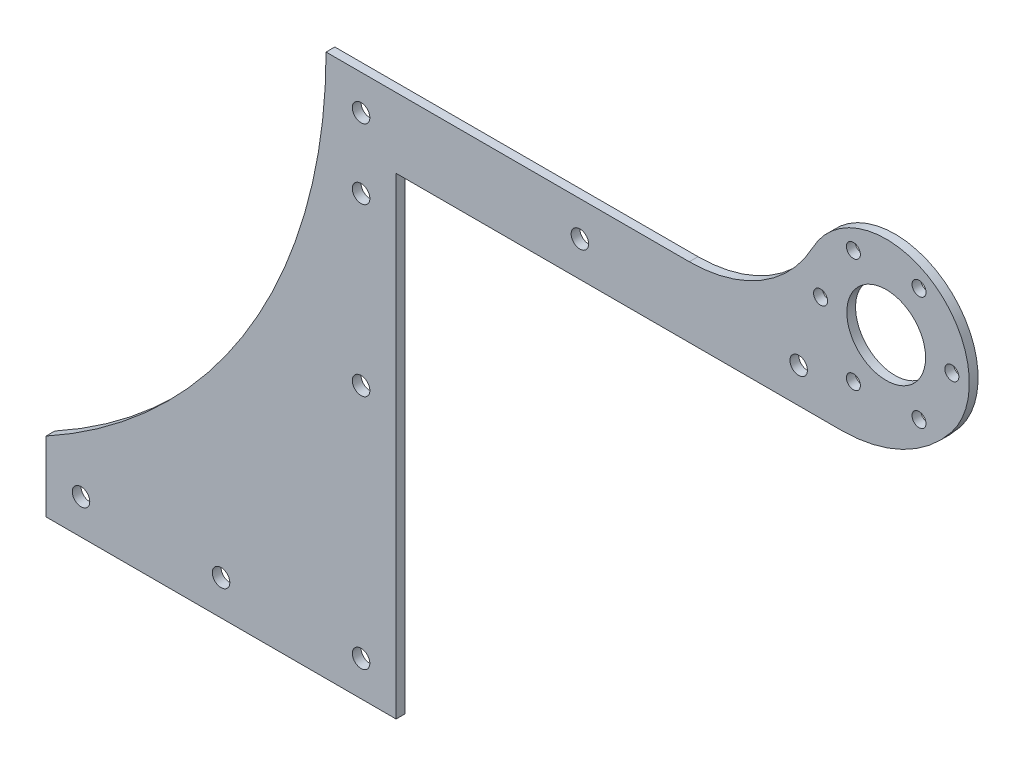
from build123d import *

# Parameters (mm, degrees)
SKETCH1_R          = 3.175
SKETCH1_R_2        = 14.2875
SKETCH1_R_3        = 2.54
BASE_FLANGE1_DEPTH = 3.175


# Sheet-metal steps are written as plain solids
with BuildPart() as part:
    # Sketch1 → Base-Flange1 (new body)
    with BuildSketch(Plane.XY):
        with BuildLine():
            Line((0, 0), (-127, 0))
            Line((-127, 0), (-127, 25.4))
            ThreePointArc((-127, 25.4), (-52.707547813, 97.203546852), (-25.4, 196.85))
            Line((-25.4, 196.85), (0, 196.85))
            Line((0, 196.85), (106.3625, 196.85))
            ThreePointArc((106.3625, 196.85), (132.498884376, 204.089359374), (151.186029412, 223.744117647))
            ThreePointArc((151.186029412, 223.744117647), (194.239231655, 234.838892203), (201.574896344, 190.988461538))
            ThreePointArc((201.574896344, 190.988461538), (183.810239349, 176.595174659), (161.532965659, 171.45))
            Line((161.532965659, 171.45), (0, 171.45))
            Line((0, 171.45), (0, 0))
        make_face()
        with Locations((-12.7, 12.7)):
            Circle(SKETCH1_R, mode=Mode.SUBTRACT)
        with Locations((-12.7, 184.15)):
            Circle(SKETCH1_R, mode=Mode.SUBTRACT)
        with Locations((-114.3, 12.7)):
            Circle(SKETCH1_R, mode=Mode.SUBTRACT)
        with Locations((-63.5, 12.7)):
            Circle(SKETCH1_R, mode=Mode.SUBTRACT)
        with Locations((-12.7, 98.425)):
            Circle(SKETCH1_R, mode=Mode.SUBTRACT)
        with Locations((177.8, 209.55)):
            Circle(SKETCH1_R_2, mode=Mode.SUBTRACT)
        with Locations((201.6125, 209.55)):
            Circle(SKETCH1_R_3, mode=Mode.SUBTRACT)
        with Locations((189.70625, 188.927770072)):
            Circle(SKETCH1_R_3, mode=Mode.SUBTRACT)
        with Locations((165.89375, 188.927770072)):
            Circle(SKETCH1_R_3, mode=Mode.SUBTRACT)
        with Locations((153.9875, 209.55)):
            Circle(SKETCH1_R_3, mode=Mode.SUBTRACT)
        with Locations((165.89375, 230.172229928)):
            Circle(SKETCH1_R_3, mode=Mode.SUBTRACT)
        with Locations((189.70625, 230.172229928)):
            Circle(SKETCH1_R_3, mode=Mode.SUBTRACT)
        with Locations((66.675, 184.15)):
            Circle(SKETCH1_R, mode=Mode.SUBTRACT)
        with Locations((-12.7, 158.75)):
            Circle(SKETCH1_R, mode=Mode.SUBTRACT)
        with Locations((146.05, 184.15)):
            Circle(SKETCH1_R, mode=Mode.SUBTRACT)
    extrude(amount=-BASE_FLANGE1_DEPTH)


solid = part.part
